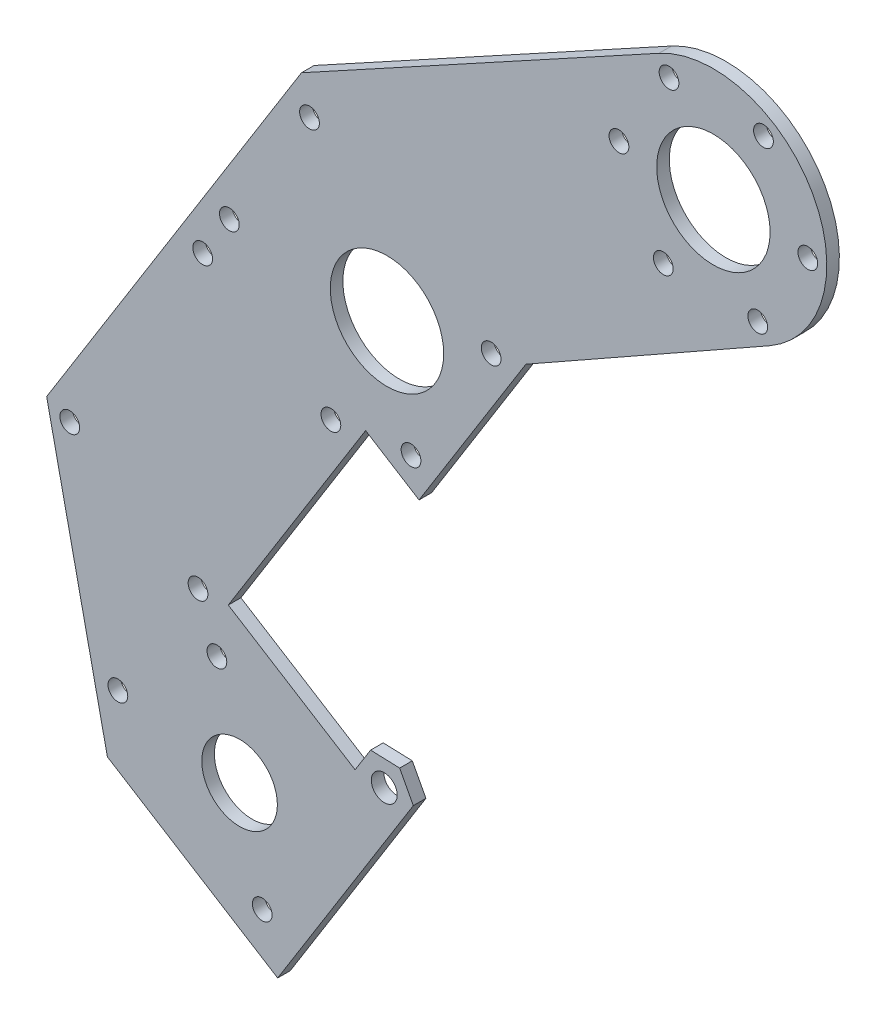
from build123d import *

# Parameters (mm, degrees)
SKETCH1_R               = 14.2875
SKETCH1_R_2             = 9.525
BOSS_EXTRUDE1_DEPTH     = 3.175
F_10_CLEARANCE_HOLE2_D  = 4.9784
F_10_CLEARANCE_HOLE3_D  = 4.9784
F_1_4_CLEARANCE_HOLE1_D = 6.5278


with BuildPart() as part:
    # Sketch1 → Boss-Extrude1 (new body)
    with BuildSketch(Plane.XY.offset(-14.194599474)):
        with BuildLine():
            Line((-11.403602879, 461.040918113), (18.881283072, 509.506866808))
            Line((18.881283072, 509.506866808), (22.784668372, 515.753589084))
            Line((22.784668372, 515.753589084), (19.342339301, 522.227668471))
            Line((19.342339301, 522.227668471), (12.014457551, 522.48356374))
            Line((12.014457551, 522.48356374), (8.11107225, 516.236841464))
            Line((8.11107225, 516.236841464), (-23.846467356, 536.206128526))
            Line((-23.846467356, 536.206128526), (10.759214603, 591.586796266))
            Line((10.759214603, 591.586796266), (24.22197813, 583.174327946))
            Line((24.22197813, 583.174327946), (51.141876753, 626.255171231))
            Line((51.141876753, 626.255171231), (112.462044501, 660.93728694))
            ThreePointArc((112.462044501, 660.93728694), (123.365099157, 699.702028842), (84.677956887, 710.877306848))
            Line((84.677956887, 710.877306848), (-5.401730059, 661.587538174))
            Line((-5.401730059, 661.587538174), (-69.615486106, 558.824047132))
            Line((-69.615486106, 558.824047132), (-54.307899735, 487.850498283))
            Line((-54.307899735, 487.850498283), (-11.403602879, 461.040918113))
        make_face()
        with Locations((16.14150623, 618.174698631)):
            Circle(SKETCH1_R, mode=Mode.SUBTRACT)
        with Locations((98.394472266, 685.809641802)):
            Circle(SKETCH1_R, mode=Mode.SUBTRACT)
        with Locations((-21.000382179, 498.8204658)):
            Circle(SKETCH1_R_2, mode=Mode.SUBTRACT)
    extrude(amount=BOSS_EXTRUDE1_DEPTH)

    # #10 Clearance Hole2 (through all)
    with Locations(Plane.XY.offset(-11.019599474)):
        with Locations((-26.71413896, 523.569465445), (-15.286625399, 474.071466154), (-3.381611976, 652.837445435), (42.391784014, 624.235053148), (22.201860047, 591.924420685), (-23.571535943, 620.526812972), (-31.474844299, 535.981130963), (-63.785476762, 556.17105493), (-51.664768266, 503.670498499), (2.009121865, 589.566678183), (-30.301510599, 609.756602151)):
            Hole(F_10_CLEARANCE_HOLE2_D / 2)

    # #10 Clearance Hole3 (through all)
    with Locations(Plane.XY.offset(-11.019599474)):
        with Locations((111.013174746, 706.003787092), (122.192466334, 684.978597537), (109.573763855, 664.784452247), (85.775769787, 665.615496512), (74.596478198, 686.640686067), (87.215180677, 706.834831357)):
            Hole(F_10_CLEARANCE_HOLE3_D / 2)

    # 1/4 Clearance Hole1 (through all)
    with Locations(Plane.XY.offset(-11.019599474)):
        with Locations((15.456786622, 516.009484354)):
            Hole(F_1_4_CLEARANCE_HOLE1_D / 2)


solid = part.part
